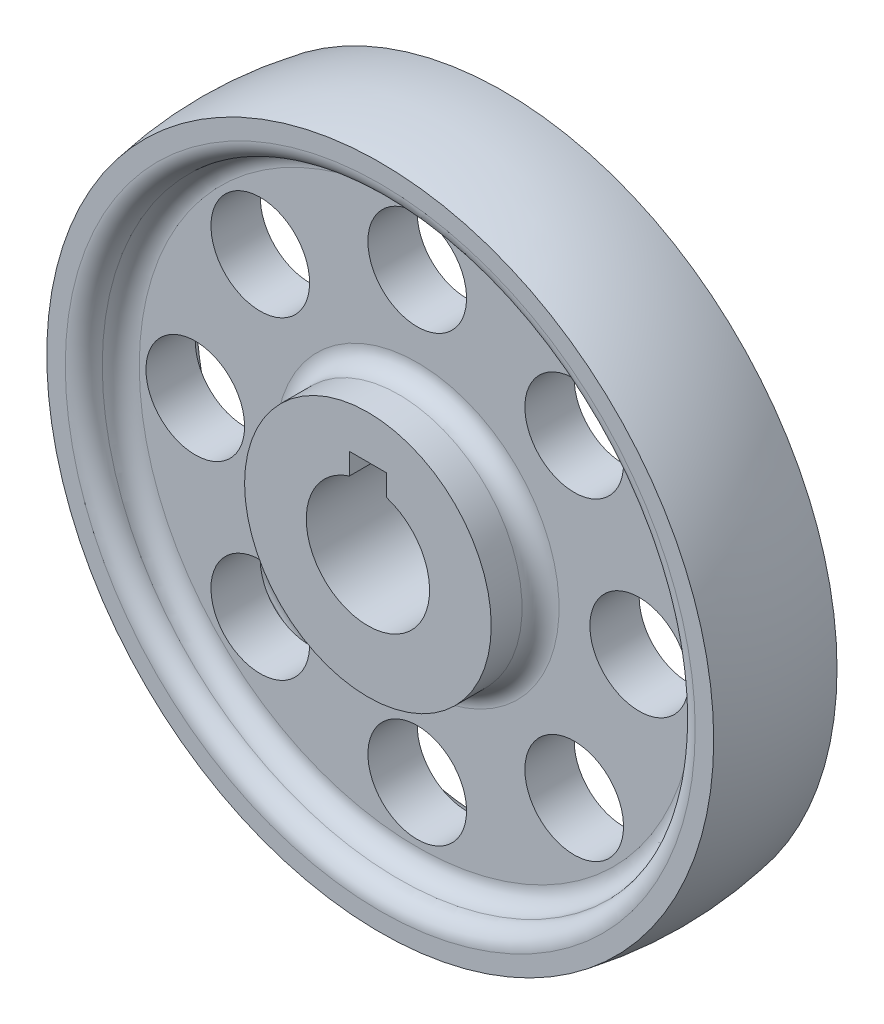
from build123d import *

# Parameters (mm, degrees)
SKETCH1_R          = 20
EXTRUDE1_DEPTH     = 16
SKETCH2_R          = 15
EXTRUDE2_DEPTH     = 8
SKETCH3_R          = 10
CUT_EXTRUDE1_DEPTH = 38.094473982
SKETCH4_W          = 6
SKETCH4_H          = 4.279835391
CUT_EXTRUDE2_DEPTH = 38.094473982
FILLET1_R          = 3
FILLET3_R          = 3
FILLET4_R          = 3
SKETCH6_R          = 8
CUT_EXTRUDE3_DEPTH = 80.410326784
CIRPATTERN1_COUNT  = 8
CUT_EXTRUDE4_DEPTH = 80.410326784
FILLET5_R          = 3


with BuildPart() as part:
    # Sketch1 → Extrude1 (new body)
    with BuildSketch(Plane.XY):
        Circle(SKETCH1_R)
    extrude(amount=EXTRUDE1_DEPTH)

    # Sketch2 → Extrude2 (add)
    with BuildSketch(Plane(origin=(0, 0, 0), x_dir=(-1, 0, 0), z_dir=(0, 0, -1))):
        with Locations(Location((0, 0, 0), (0, 0, 180))):
            Circle(SKETCH2_R)
    extrude(amount=EXTRUDE2_DEPTH)

    # Sketch3 → Cut-Extrude1 (cut, through all)
    with BuildSketch(Plane(origin=(0, 0, -8), x_dir=(-1, 0, 0), z_dir=(0, 0, -1))):
        Circle(SKETCH3_R)
    extrude(amount=-CUT_EXTRUDE1_DEPTH, mode=Mode.SUBTRACT)

    # Sketch4 → Cut-Extrude2 (cut, through all)
    with BuildSketch(Plane(origin=(0, 0, -8), x_dir=(-1, 0, 0), z_dir=(0, 0, -1))):
        with Locations((0, 10.860082305)):
            Rectangle(SKETCH4_W, SKETCH4_H)
    extrude(amount=-CUT_EXTRUDE2_DEPTH, mode=Mode.SUBTRACT)

    # Fillet1
    fillet1_edges = [part.edges().sort_by_distance(p)[0] for p in [
        (-15, 0, 0),
    ]]
    fillet(fillet1_edges, radius=FILLET1_R)

    # Sketch5 → Revolve1 (revolve)
    with BuildSketch(Plane(origin=(0, 0, 0), x_dir=(1, 0, 0), z_dir=(0, 1, 0)), mode=Mode.PRIVATE) as revolve1_sk:
        with BuildLine():
            Line((0, -8), (48.083269132, -8))
            Line((48.083269132, -8), (48.083269132, -14))
            Line((48.083269132, -14), (54.083269132, -14))
            ThreePointArc((54.083269132, -14), (55, -4), (54.083269132, 6))
            Line((54.083269132, 6), (48.083269132, 6))
            Line((48.083269132, 6), (48.083269132, 0))
            Line((48.083269132, 0), (0, 0))
            Line((0, 0), (0, -8))
        make_face()
    revolve(revolve1_sk.sketch.rotate(Axis((0, 0, 0), (0, 0, 1)), 180), axis=Axis((0, 0, 0), (0, 0, 1)))

    # Fillet3
    fillet3_edges = [part.edges().sort_by_distance(p)[0] for p in [
        (48.083269132, 0, 0),
        (48.083269132, 0, -6),
    ]]
    fillet(fillet3_edges, radius=FILLET3_R - 0.0001)  # a hair under: the kernel refuses the full size

    # Fillet4
    fillet4_edges = [part.edges().sort_by_distance(p)[0] for p in [
        (48.083269132, 0, 14),
        (48.083269132, 0, 8),
    ]]
    fillet(fillet4_edges, radius=FILLET4_R - 0.0001)  # a hair under: the kernel refuses the full size

    # Sketch6 → Cut-Extrude3 (cut, through all)
    with BuildSketch(Plane(origin=(0, 0, 0), x_dir=(-1, 0, 0), z_dir=(0, 0, -1))):
        with Locations((0, 36)):
            Circle(SKETCH6_R)
    cut_extrude3 = extrude(amount=-CUT_EXTRUDE3_DEPTH, mode=Mode.SUBTRACT)

    # CirPattern1: Cut-Extrude3 ×8 about axis
    cirpattern1_axis = Axis((0, 0, 0), (0, 0, 1))
    for i in range(1, CIRPATTERN1_COUNT):
        add(cut_extrude3.rotate(cirpattern1_axis, i * 360 / CIRPATTERN1_COUNT), mode=Mode.SUBTRACT)

    # Sketch7 → Cut-Extrude4 (cut, through all)
    with BuildSketch(Plane(origin=(0, 0, 0), x_dir=(-1, 0, 0), z_dir=(0, 0, -1))):
        with BuildLine():
            Line((3, 9.539392014), (3, 13))
            Line((3, 13), (-3, 13))
            Line((-3, 13), (-3, 9.539392014))
            ThreePointArc((-3, 9.539392014), (0, -10), (3, 9.539392014))
        make_face()
    extrude(amount=-CUT_EXTRUDE4_DEPTH, mode=Mode.SUBTRACT)

    # Fillet5
    fillet5_edges = [part.edges().sort_by_distance(p)[0] for p in [
        (-20, 0, 8),
    ]]
    fillet(fillet5_edges, radius=FILLET5_R)


solid = part.part
